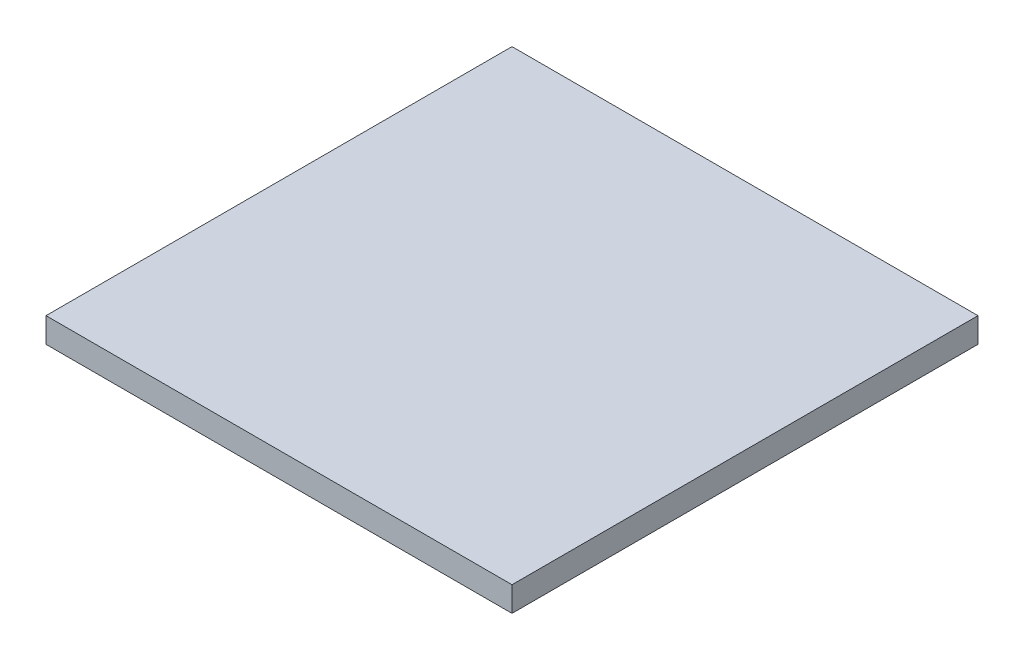
from build123d import *

# Parameters (mm, degrees)
SKETCH_1_W             = 150
SKETCH_1_H             = 150
SM_BASE_FLANGE_1_DEPTH = 8


# Sheet-metal steps are written as plain solids
with BuildPart() as part:
    # Sketch 1 → Базовая кромка1 (new body)
    with BuildSketch(Plane(origin=(0, 0, 0), x_dir=(1, 0, 0), z_dir=(0, 1, 0))):
        Rectangle(SKETCH_1_W, SKETCH_1_H)
    extrude(amount=-SM_BASE_FLANGE_1_DEPTH)


solid = part.part
